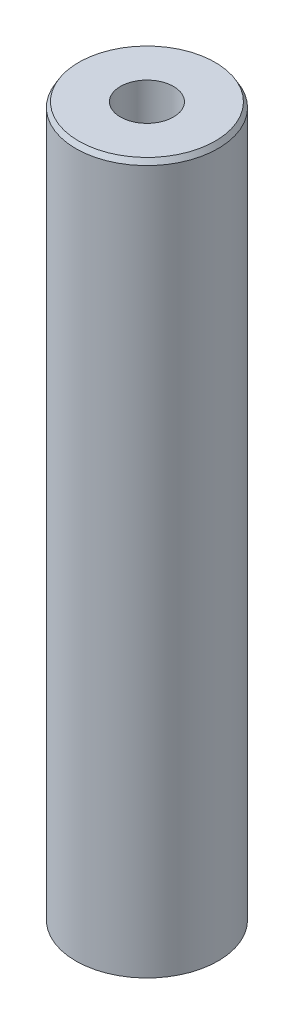
from build123d import *
from OCP.BRepFilletAPI import BRepFilletAPI_MakeChamfer

# Parameters (mm, degrees)
SKETCH1_R           = 60
BOSS_EXTRUDE1_DEPTH = 600
SKETCH2_R           = 22.379064953
CUT_EXTRUDE1_DEPTH  = 606.970296302
CHAMFER1_SIZE       = 4.237510699
CHAMFER1_SIZE2      = 2.446527943


with BuildPart() as part:
    # Sketch1 → Boss-Extrude1 (new body)
    with BuildSketch(Plane(origin=(0, 0, 0), x_dir=(1, 0, 0), z_dir=(0, 1, 0))):
        Circle(SKETCH1_R)
    extrude(amount=BOSS_EXTRUDE1_DEPTH)

    # Sketch2 → Cut-Extrude1 (cut, through all)
    with BuildSketch(Plane(origin=(0, 0, 0), x_dir=(1, 0, 0), z_dir=(0, 1, 0))):
        Circle(SKETCH2_R)
    extrude(amount=CUT_EXTRUDE1_DEPTH, mode=Mode.SUBTRACT)

    # Chamfer1: one chamfer whose edges measure the first distance from different faces: ONE call of the kernel's chamfer builder (chamfer() names one face for all edges)
    chamfer1_edges_1 = [part.edges().sort_by_distance(p)[0] for p in [
        (-60, 600, 0),
    ]]
    chamfer1_side_1 = [part.faces().sort_by_distance(p)[0] for p in [
        (-60, 300, 0),
    ]]
    chamfer1_edges_2 = [part.edges().sort_by_distance(p)[0] for p in [
        (-60, 0, 0),
    ]]
    chamfer1_side_2 = [part.faces().sort_by_distance(p)[0] for p in [
        (-58.302943725, 0, 0),
    ]]
    chamfer1 = BRepFilletAPI_MakeChamfer(part.part.solid().wrapped)
    for e in chamfer1_edges_1:
        chamfer1.Add(CHAMFER1_SIZE, CHAMFER1_SIZE2, e.wrapped, chamfer1_side_1[0].wrapped)  # the first distance lies on this face
    for e in chamfer1_edges_2:
        chamfer1.Add(CHAMFER1_SIZE, CHAMFER1_SIZE2, e.wrapped, chamfer1_side_2[0].wrapped)  # the first distance lies on this face
    add(Compound.cast(chamfer1.Shape()), mode=Mode.REPLACE)


solid = part.part
